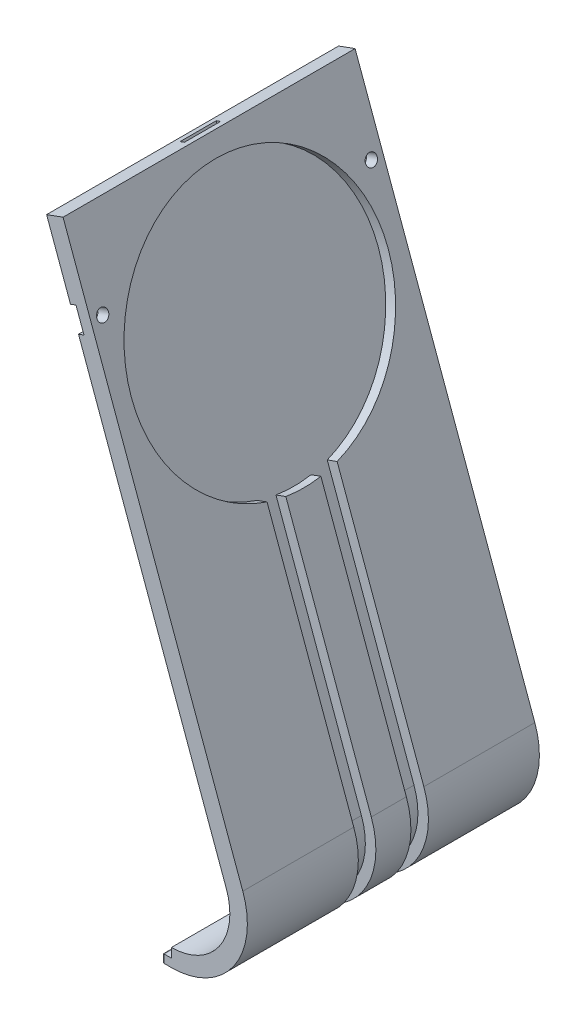
from build123d import *

# Parameters (mm, degrees)
EXTRUDE_1_DEPTH        = 25
SKETCH_4_R             = 22
CUT_EXTRUDE_1_DEPTH    = 1.8
CUT_EXTRUDE_START      = 6
CUT_EXTRUDE_1_2_DEPTH  = 3
SKETCH_11_W            = 18.9
SKETCH_11_H            = 1.4
EXTRUDE_3_DEPTH        = 1.5
FILLET_1_R             = 0.25
SKETCH_12_R            = 1
CUT_EXTRUDE_2570_DEPTH = 99.437390504
CUT_EXTRUDE_1_3_DEPTH  = 1
SKETCH_14_W            = 0.8
SKETCH_14_H            = 6.2
CUT_EXTRUDE_2_DEPTH    = 1


with BuildPart() as part:
    # 草图2 → 整体拉伸-薄壁1 (new, symmetric)
    with BuildSketch(Plane.XY):
        with BuildLine():
            ThreePointArc((28.874192719, 5.049687275), (37.065713162, 9.313922912), (38.271118927, 18.469888708))
            Line((38.271118927, 18.469888708), (7.496652644, 103.022039918))
            Line((7.496652644, 103.022039918), (10.315730506, 104.048100348))
            Line((10.315730506, 104.048100348), (41.090196789, 19.495949138))
            ThreePointArc((41.090196789, 19.495949138), (39.523169295, 7.593193603), (28.874192719, 2.049687275))
            Line((28.874192719, 2.049687275), (28.874192719, 5.049687275))
        make_face()
    extrude(amount=EXTRUDE_1_DEPTH, both=True)

    # 草图4 → Cut-Extrude 1 (cut)
    with BuildSketch(Plane(origin=(42.549434126, 15.486727507, 0), x_dir=(0, 0, -1), z_dir=(0.9396926207859071, 0.3420201433256726, 0))):
        with Locations((0, 68.845044478)):
            Circle(SKETCH_4_R)
    extrude(amount=-CUT_EXTRUDE_1_DEPTH, mode=Mode.SUBTRACT)

    # 草图3 → Cut-Extrude 1 2 (cut)
    with BuildSketch(Plane.XY.offset(CUT_EXTRUDE_START)):
        with BuildLine():
            ThreePointArc((28.874192719, 3.849687275), (38.048695615, 8.625631188), (39.398750072, 18.88031288))
            Line((39.398750072, 18.88031288), (24.836038582, 58.891033865))
            Line((24.836038582, 58.891033865), (23.809978152, 61.710111727))
            Line((23.809978152, 61.710111727), (25.50142487, 62.325747985))
            Line((25.50142487, 62.325747985), (26.5274853, 59.506670123))
            Line((26.5274853, 59.506670123), (41.090196789, 19.495949138))
            ThreePointArc((41.090196789, 19.495949138), (39.523169295, 7.593193603), (28.874192719, 2.049687275))
            Line((28.874192719, 2.049687275), (28.874192719, 3.849687275))
        make_face()
    cut_extrude_1_2 = extrude(amount=-CUT_EXTRUDE_1_2_DEPTH, mode=Mode.SUBTRACT)

    # 镜向1: Cut-Extrude 1 2 across plane
    add(cut_extrude_1_2.mirror(Plane.XY), mode=Mode.SUBTRACT)

    # 草图11 → 底部卡扣凸台-拉伸3 (add)
    with BuildSketch(Plane.ZY.offset(-28.874192719)):
        with Locations((-15.55, 2.749687275)):
            Rectangle(SKETCH_11_W, SKETCH_11_H)
        with Locations((15.55, 2.749687275)):
            Rectangle(SKETCH_11_W, SKETCH_11_H)
    extrude(amount=EXTRUDE_3_DEPTH)

    # 底部卡扣圆角1
    fillet_1_edges = [part.edges().sort_by_distance(p)[0] for p in [
        (27.374192719, 3.449687275, 15.55),
        (27.374192719, 2.749687275, 25),
        (27.374192719, 2.049687275, 15.55),
        (27.374192719, 2.749687275, 6.1),
        (27.374192719, 3.449687275, -15.55),
        (27.374192719, 2.749687275, -6.1),
        (27.374192719, 2.049687275, -15.55),
        (27.374192719, 2.749687275, -25),
    ]]
    fillet(fillet_1_edges, radius=FILLET_1_R)

    # 草图12 → Cut-Extrude 2570 (cut, through all)
    with BuildSketch(Plane(origin=(39.730356264, 14.460667077, 0), x_dir=(0, 0, 1), z_dir=(-0.9396926207859071, -0.3420201433256726, 0))):
        with Locations((23, 80.282840932)):
            Circle(SKETCH_12_R)
        with Locations((-23, 80.282840932)):
            Circle(SKETCH_12_R)
    extrude(amount=-CUT_EXTRUDE_2570_DEPTH, mode=Mode.SUBTRACT)

    # 草图13 → Cut-Extrude 1 3 (cut)
    with BuildSketch(Plane(origin=(39.730356264, 14.460667077, 0), x_dir=(0, 0, 1), z_dir=(-0.9396926207859071, -0.3420201433256726, 0))):
        with BuildLine():
            Line((23, 82.282840932), (25, 82.282840932))
            Line((25, 82.282840932), (25, 78.282840932))
            Line((25, 78.282840932), (23, 78.282840932))
            ThreePointArc((23, 78.282840932), (21, 80.282840932), (23, 82.282840932))
        make_face()
        with BuildLine():
            Line((-25, 82.282840932), (-25, 78.282840932))
            Line((-25, 78.282840932), (-23, 78.282840932))
            ThreePointArc((-23, 78.282840932), (-21, 80.282840932), (-23, 82.282840932))
            Line((-23, 82.282840932), (-25, 82.282840932))
        make_face()
    extrude(amount=-CUT_EXTRUDE_1_3_DEPTH, mode=Mode.SUBTRACT)

    # 草图14 → 切除-拉伸2 (cut)
    with BuildSketch(Plane(origin=(-32.23370362, 88.561372842, 0), x_dir=(0.9396926207859067, 0.3420201433256736, 0), z_dir=(-0.3420201433256736, 0.9396926207859068, 0))):
        with Locations((43.680162028, 0)):
            Rectangle(SKETCH_14_W, SKETCH_14_H)
    extrude(amount=-CUT_EXTRUDE_2_DEPTH, mode=Mode.SUBTRACT)


solid = part.part
